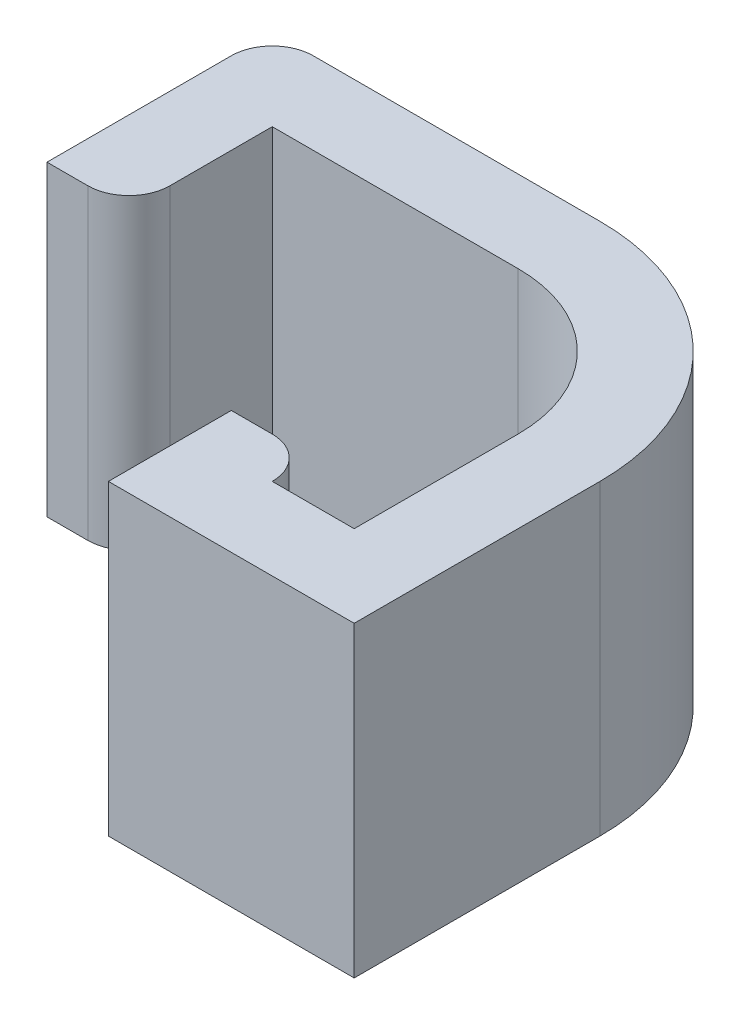
from build123d import *

# Parameters (mm, degrees)
BOSS_EXTRUDE1_DEPTH = 15
FILLET1_R           = 2


with BuildPart() as part:
    # Sketch1 → Boss-Extrude1 (new body)
    with BuildSketch(Plane(origin=(0, 0, 0), x_dir=(1, 0, 0), z_dir=(0, 1, 0))):
        with BuildLine():
            Line((0, 0), (0, 7))
            Line((0, 7), (12, 7))
            ThreePointArc((12, 7), (16.949747468, 4.949747468), (19, 0))
            Line((19, 0), (19, -8))
            Line((19, -8), (15, -8))
            Line((15, -8), (15, -6))
            Line((15, -6), (11, -6))
            Line((11, -6), (11, -12))
            Line((11, -12), (23, -12))
            Line((23, -12), (23, 0))
            ThreePointArc((23, 0), (19.778174593, 7.778174593), (12, 11))
            Line((12, 11), (-4, 11))
            Line((-4, 11), (-4, 0))
            Line((-4, 0), (0, 0))
        make_face()
    extrude(amount=BOSS_EXTRUDE1_DEPTH)

    # Fillet1
    fillet1_edges = [part.edges().sort_by_distance(p)[0] for p in [
        (15, 7.5, 6),
        (0, 7.5, 0),
        (-4, 7.5, -11),
    ]]
    fillet(fillet1_edges, radius=FILLET1_R - 0.0001)  # a hair under: the kernel refuses the full size


solid = part.part
